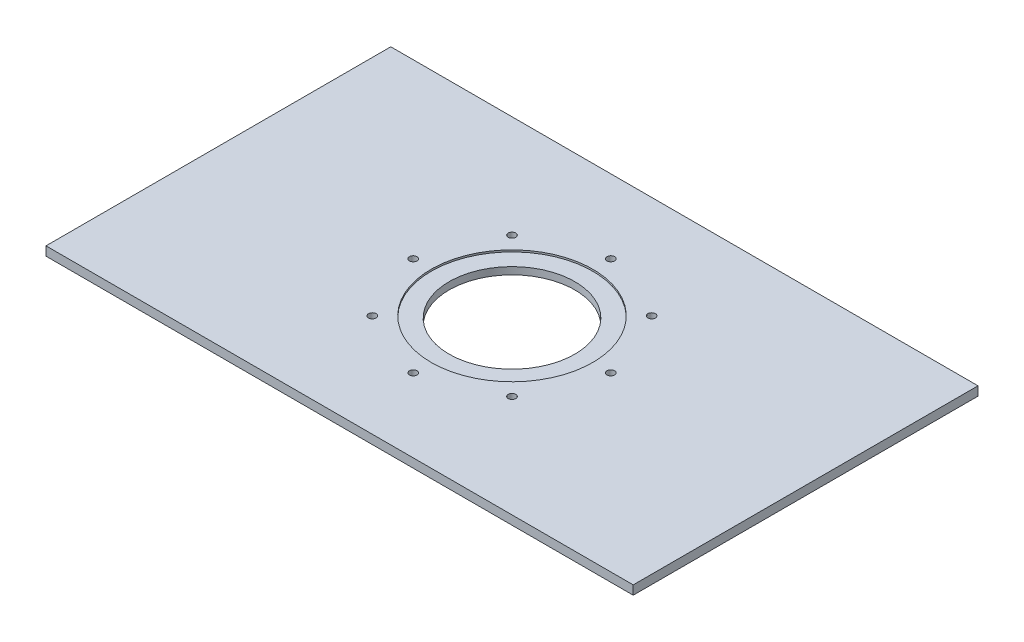
from build123d import *

# Parameters (mm, degrees)
SKETCH1_W                    = 327
SKETCH1_H                    = 192
BOSS_EXTRUDE1_DEPTH          = 5
SKETCH2_R                    = 35
CUT_EXTRUDE1_DEPTH           = 190.666154071
SKETCH3_R                    = 45
CUT_EXTRUDE2_DEPTH           = 1
TAP_DRILL_FOR_M4_HELICOIL1_D = 4.2


with BuildPart() as part:
    # Sketch1 → Boss-Extrude1 (new body)
    with BuildSketch(Plane(origin=(0, 0, 0), x_dir=(1, 0, 0), z_dir=(0, 1, 0))):
        Rectangle(SKETCH1_W, SKETCH1_H)
    extrude(amount=BOSS_EXTRUDE1_DEPTH)

    # Sketch2 → Cut-Extrude1 (cut, through all)
    with BuildSketch(Plane(origin=(0, 5, 0), x_dir=(1, 0, 0), z_dir=(0, 1, 0))):
        Circle(SKETCH2_R)
    extrude(amount=-CUT_EXTRUDE1_DEPTH, mode=Mode.SUBTRACT)

    # Sketch3 → Cut-Extrude2 (cut)
    with BuildSketch(Plane(origin=(0, 5, 0), x_dir=(1, 0, 0), z_dir=(0, 1, 0))):
        Circle(SKETCH3_R)
    extrude(amount=-CUT_EXTRUDE2_DEPTH, mode=Mode.SUBTRACT)

    # Tap Drill for M4 Helicoil1 (through all)
    with Locations(Plane(origin=(0, 5, 0), x_dir=(1, 0, 0), z_dir=(0, 1, 0))):
        with Locations((-38.890872965, -38.890872965), (-55, 0), (-38.890872965, 38.890872965), (0, 55), (38.890872965, 38.890872965), (55, 0), (38.890872965, -38.890872965), (0, -55)):
            Hole(TAP_DRILL_FOR_M4_HELICOIL1_D / 2)


solid = part.part
